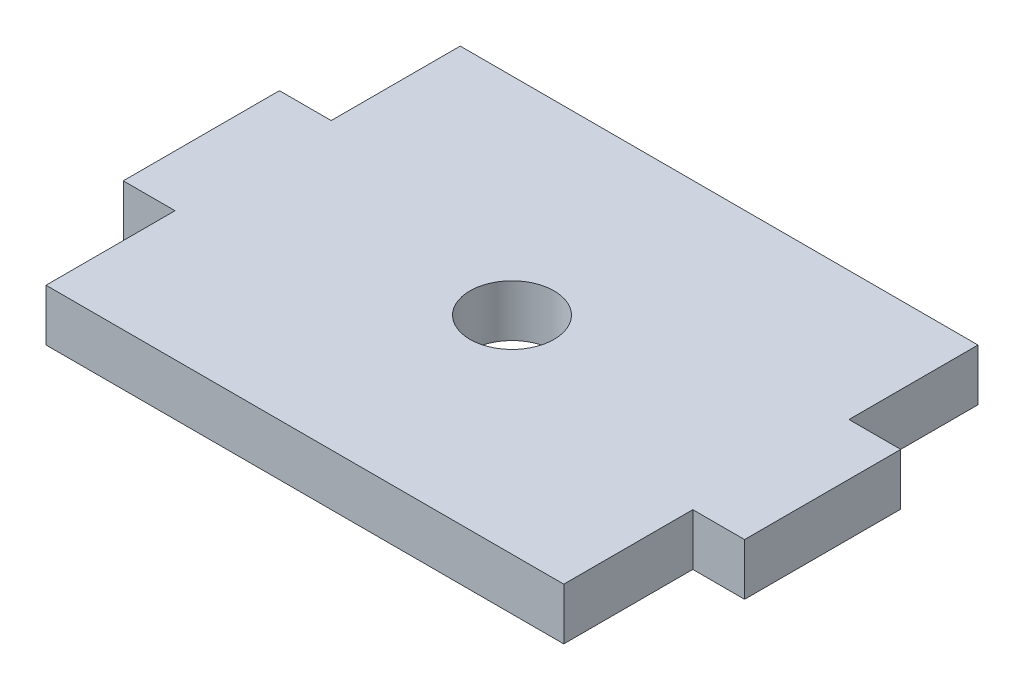
from build123d import *

# Parameters (mm, degrees)
SKETCH1_R           = 2.5796875
BOSS_EXTRUDE1_DEPTH = 1.5875


with BuildPart() as part:
    # Sketch1 → Boss-Extrude1 (new, symmetric)
    with BuildSketch(Plane(origin=(0, 0, 0), x_dir=(1, 0, 0), z_dir=(0, 1, 0))):
        Polygon((-19.05, -4.7879), (-15.875, -4.7879), (-15.875, -12.7), (15.875, -12.7), (15.875, -4.7879), (19.05, -4.7879), (19.05, 4.7879), (15.875, 4.7879), (15.875, 12.7), (-15.875, 12.7), (-15.875, 4.7879), (-19.05, 4.7879), align=None)
        Circle(SKETCH1_R, mode=Mode.SUBTRACT)
    extrude(amount=BOSS_EXTRUDE1_DEPTH, both=True)


solid = part.part
